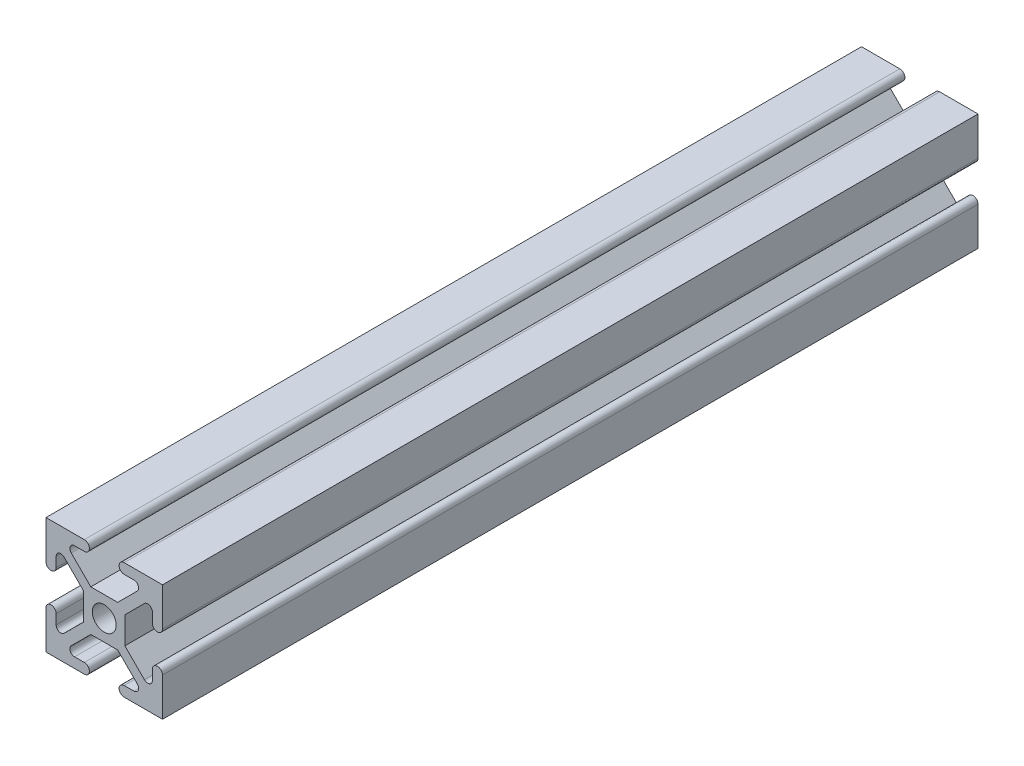
from build123d import *

# Parameters (mm, degrees)
SKETCH1_R           = 2.6035
BOSS_EXTRUDE1_DEPTH = 177.8


with BuildPart() as part:
    # Sketch1 → Boss-Extrude1 (new body)
    with BuildSketch(Plane.XY):
        with BuildLine():
            Line((-12.7, -12.7), (-4.343399971, -12.7))
            ThreePointArc((-4.343399971, -12.7), (-3.238499971, -11.5951), (-4.343399971, -10.4902))
            Line((-4.343399971, -10.4902), (-6.474794456, -10.4902))
            ThreePointArc((-6.474794456, -10.4902), (-7.413456061, -9.863006367), (-7.193214945, -8.75577951))
            Line((-7.193214945, -8.75577951), (-2.933235435, -4.4958))
            Line((-2.933235435, -4.4958), (2.933235435, -4.4958))
            Line((2.933235435, -4.4958), (7.193214945, -8.75577951))
            ThreePointArc((7.193214945, -8.75577951), (7.413456061, -9.863006367), (6.474794456, -10.4902))
            Line((6.474794456, -10.4902), (4.3434, -10.4902))
            ThreePointArc((4.3434, -10.4902), (3.2385, -11.5951), (4.3434, -12.7))
            Line((4.3434, -12.7), (12.7, -12.7))
            Line((12.7, -12.7), (12.7, -4.343399971))
            ThreePointArc((12.7, -4.343399971), (11.5951, -3.238499971), (10.4902, -4.343399971))
            Line((10.4902, -4.343399971), (10.4902, -6.474794456))
            ThreePointArc((10.4902, -6.474794456), (9.863006367, -7.413456061), (8.75577951, -7.193214945))
            Line((8.75577951, -7.193214945), (4.4958, -2.933235435))
            Line((4.4958, -2.933235435), (4.4958, 2.933235435))
            Line((4.4958, 2.933235435), (8.75577951, 7.193214945))
            ThreePointArc((8.75577951, 7.193214945), (9.863006367, 7.413456061), (10.4902, 6.474794456))
            Line((10.4902, 6.474794456), (10.4902, 4.3434))
            ThreePointArc((10.4902, 4.3434), (11.5951, 3.2385), (12.7, 4.3434))
            Line((12.7, 4.3434), (12.7, 12.7))
            Line((12.7, 12.7), (4.343399971, 12.7))
            ThreePointArc((4.343399971, 12.7), (3.238499971, 11.5951), (4.343399971, 10.4902))
            Line((4.343399971, 10.4902), (6.474794456, 10.4902))
            ThreePointArc((6.474794456, 10.4902), (7.413456061, 9.863006367), (7.193214945, 8.75577951))
            Line((7.193214945, 8.75577951), (2.933235435, 4.4958))
            Line((2.933235435, 4.4958), (-2.933235435, 4.4958))
            Line((-2.933235435, 4.4958), (-7.193214945, 8.75577951))
            ThreePointArc((-7.193214945, 8.75577951), (-7.413456061, 9.863006367), (-6.474794456, 10.4902))
            Line((-6.474794456, 10.4902), (-4.3434, 10.4902))
            ThreePointArc((-4.3434, 10.4902), (-3.2385, 11.5951), (-4.3434, 12.7))
            Line((-4.3434, 12.7), (-12.7, 12.7))
            Line((-12.7, 12.7), (-12.7, 4.343399971))
            ThreePointArc((-12.7, 4.343399971), (-11.5951, 3.238499971), (-10.4902, 4.343399971))
            Line((-10.4902, 4.343399971), (-10.4902, 6.474794456))
            ThreePointArc((-10.4902, 6.474794456), (-9.863006367, 7.413456061), (-8.75577951, 7.193214945))
            Line((-8.75577951, 7.193214945), (-4.4958, 2.933235435))
            Line((-4.4958, 2.933235435), (-4.4958, -2.933235435))
            Line((-4.4958, -2.933235435), (-8.75577951, -7.193214945))
            ThreePointArc((-8.75577951, -7.193214945), (-9.863006367, -7.413456061), (-10.4902, -6.474794456))
            Line((-10.4902, -6.474794456), (-10.4902, -4.3434))
            ThreePointArc((-10.4902, -4.3434), (-11.5951, -3.2385), (-12.7, -4.3434))
            Line((-12.7, -4.3434), (-12.7, -12.7))
        make_face()
        Circle(SKETCH1_R, mode=Mode.SUBTRACT)
    extrude(amount=-BOSS_EXTRUDE1_DEPTH)


solid = part.part
